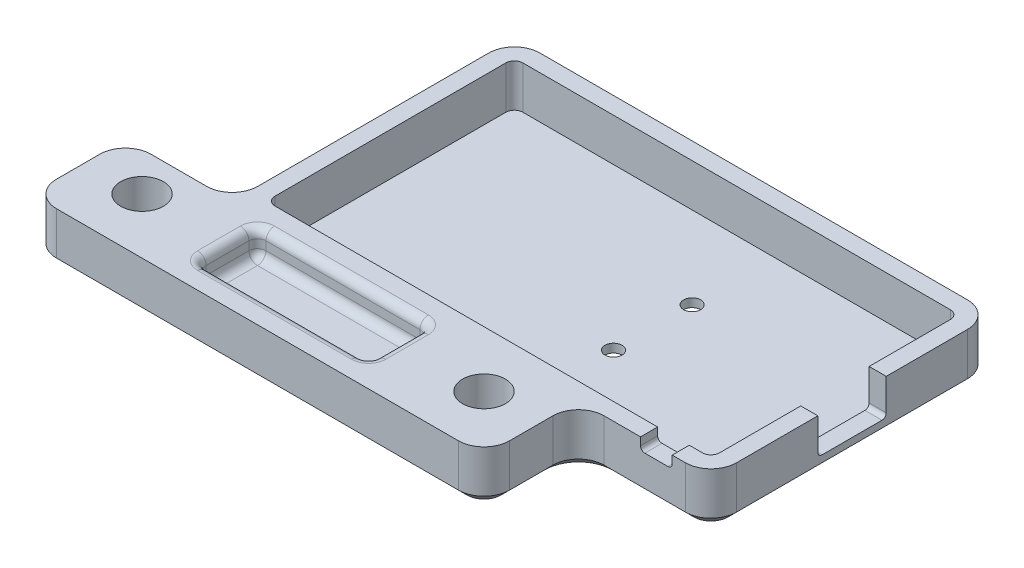
from build123d import *

# Parameters (mm, degrees)
SKETCH1_W           = 56
SKETCH1_H           = 33
SKETCH1_W_2         = 52
SKETCH1_H_2         = 29
BOSS_EXTRUDE1_DEPTH = 5
SKETCH2_W           = 56
SKETCH2_H           = 33
BOSS_EXTRUDE2_DEPTH = 1
FILLET1_R           = 3
FILLET2_R           = 1
SKETCH3_W           = 8
SKETCH3_H           = 8.4
CUT_EXTRUDE1_DEPTH  = 10
SKETCH9_W           = 3.7
SKETCH9_H           = 2.8
CUT_EXTRUDE4_DEPTH  = 3
BOSS_EXTRUDE6_START = -6
SKETCH5_R           = 4.5
BOSS_EXTRUDE6_DEPTH = 6
SKETCH7_R           = 4.5
SKETCH7_R_2         = 2.5
BOSS_EXTRUDE7_DEPTH = 5
FILLET4_R           = 3
SKETCH8_W           = 20
SKETCH8_H           = 7
CUT_EXTRUDE3_DEPTH  = 3
FILLET5_R           = 1
CHAMFER2_SIZE       = 1
FILLET6_R           = 0.5
SKETCH10_R          = 1
CUT_EXTRUDE5_DEPTH  = 3


with BuildPart() as part:
    # Sketch1 → Boss-Extrude1 (new body)
    with BuildSketch(Plane(origin=(0, 0, 0), x_dir=(1, 0, 0), z_dir=(0, 1, 0))):
        Rectangle(SKETCH1_W, SKETCH1_H)
        Rectangle(SKETCH1_W_2, SKETCH1_H_2, mode=Mode.SUBTRACT)
    extrude(amount=BOSS_EXTRUDE1_DEPTH)

    # Sketch2 → Boss-Extrude2 (add)
    with BuildSketch(Plane.XZ):
        Rectangle(SKETCH2_W, SKETCH2_H)
    extrude(amount=BOSS_EXTRUDE2_DEPTH)

    # Fillet1
    fillet1_edges = [part.edges().sort_by_distance(p)[0] for p in [
        (-28, 2, -16.5),
        (28, 2, -16.5),
        (28, 2, 16.5),
        (-28, 2, 16.5),
    ]]
    fillet(fillet1_edges, radius=FILLET1_R)

    # Fillet2
    fillet2_edges = [part.edges().sort_by_distance(p)[0] for p in [
        (26, 2.5, 14.5),
        (26, 2.5, -14.5),
        (-26, 2.5, -14.5),
        (-26, 2.5, 14.5),
    ]]
    fillet(fillet2_edges, radius=FILLET2_R)

    # Sketch3 → Cut-Extrude1 (cut)
    with BuildSketch(Plane(origin=(28, 0, 0), x_dir=(0, 0, -1), z_dir=(1, 0, 0))):
        with Locations((0, 5)):
            Rectangle(SKETCH3_W, SKETCH3_H)
    extrude(amount=-CUT_EXTRUDE1_DEPTH, mode=Mode.SUBTRACT)

    # Sketch9 → Cut-Extrude4 (cut)
    with BuildSketch(Plane.XY.offset(16.5)):
        with Locations((21.611723176, 5)):
            Rectangle(SKETCH9_W, SKETCH9_H)
    extrude(amount=-CUT_EXTRUDE4_DEPTH, mode=Mode.SUBTRACT)

    # Sketch5 → Boss-Extrude6 (add)
    # profile 1 of 3: a face of its own
    with BuildSketch(Plane.XZ.offset(1).offset(BOSS_EXTRUDE6_START)):
        Polygon((-25, 16.5), (12.5, 16.5), (12.5, 27.55), (-40.5, 27.55), (-40.5, 16.5), (-28, 16.5), align=None)
        with Locations(Location((-34, 21.05, 0), (0, 0, 270))):
            Circle(SKETCH5_R, mode=Mode.SUBTRACT)
        with Locations(Location((6, 21.05, 0), (0, 0, 270))):
            Circle(SKETCH5_R, mode=Mode.SUBTRACT)
    # profile 2 of 3: a face of its own
    with BuildSketch(Plane.XZ.offset(1).offset(BOSS_EXTRUDE6_START)):
        with BuildLine():
            ThreePointArc((-27.252149964, 15.481872988), (-26.2357955, 16.233643993), (-25, 16.5))
            Line((-25, 16.5), (-28, 16.5))
            Line((-28, 16.5), (-28, 15.481872988))
            Line((-28, 15.481872988), (-27.252149964, 15.481872988))
        make_face()
    # profile 3 of 3: a face of its own
    with BuildSketch(Plane.XZ.offset(1).offset(BOSS_EXTRUDE6_START)):
        with BuildLine():
            ThreePointArc((-28, 13.5), (-27.806817583, 14.559138826), (-27.252149964, 15.481872988))
            Line((-27.252149964, 15.481872988), (-28, 15.481872988))
            Line((-28, 15.481872988), (-28, 13.5))
        make_face()
    extrude(amount=BOSS_EXTRUDE6_DEPTH)

    # Sketch7 → Boss-Extrude7 (add)
    # profile 1 of 2: a face of its own
    with BuildSketch(Plane(origin=(0, 5, 0), x_dir=(1, 0, 0), z_dir=(0, 1, 0))):
        with Locations(Location((6, -21.05, 0), (0, 0, 90))):
            Circle(SKETCH7_R)
        with Locations(Location((6, -21.05, 0), (0, 0, 270))):
            Circle(SKETCH7_R_2, mode=Mode.SUBTRACT)
    # profile 2 of 2: a face of its own
    with BuildSketch(Plane(origin=(0, 5, 0), x_dir=(1, 0, 0), z_dir=(0, 1, 0))):
        with Locations(Location((-34, -21.05, 0), (0, 0, 90))):
            Circle(SKETCH7_R)
        with Locations(Location((-34, -21.05, 0), (0, 0, 270))):
            Circle(SKETCH7_R_2, mode=Mode.SUBTRACT)
    extrude(amount=-BOSS_EXTRUDE7_DEPTH)

    # Fillet4
    fillet4_edges = [part.edges().sort_by_distance(p)[0] for p in [
        (-40.5, 2, 16.5),
        (-40.5, 2, 27.55),
        (12.5, 2, 27.55),
        (12.5, 2, 16.5),
        (-28, 2, 16.5),
    ]]
    fillet(fillet4_edges, radius=FILLET4_R)

    # Sketch8 → Cut-Extrude3 (cut)
    with BuildSketch(Plane(origin=(0, 5, 0), x_dir=(1, 0, 0), z_dir=(0, 1, 0))):
        with Locations((-14, -21.05)):
            Rectangle(SKETCH8_W, SKETCH8_H)
    extrude(amount=-CUT_EXTRUDE3_DEPTH, mode=Mode.SUBTRACT)

    # Fillet5
    fillet5_edges = [part.edges().sort_by_distance(p)[0] for p in [
        (-4, 2, 21.05),
        (-4, 3.5, 17.55),
        (-14, 2, 24.55),
        (-4, 3.5, 24.55),
        (-24, 2, 21.05),
        (-24, 3.5, 24.55),
        (-14, 2, 17.55),
        (-24, 3.5, 17.55),
        (-4, 5, 21.05),
        (-14, 5, 17.55),
        (-24, 5, 21.05),
        (-14, 5, 24.55),
    ]]
    fillet(fillet5_edges, radius=FILLET5_R)

    # Chamfer2
    # the kernel refuses this chamfer: 1 mm, written as the material it takes off along each edge
    with BuildSketch(Plane(origin=(12.5, -1, 19.5), x_dir=(0.02749587661058563, 0.9996219169112968, 0), z_dir=(0, 0, 1)), Plane(origin=(-40.5, -1, 24.55), x_dir=(-0.02749587661058908, 0.9996219169112968, 0), z_dir=(0, 0, -1))) as chamfer2_piece_1:
        Polygon((CHAMFER2_SIZE * 0.999621916911, CHAMFER2_SIZE * 0.0274958766106), (-CHAMFER2_SIZE * 0.0274958766106, CHAMFER2_SIZE * 0.999621916911), (0, 0), align=None)
    extrude(amount=5.05, mode=Mode.SUBTRACT)
    with BuildSketch(Plane(origin=(9.5, -1, 27.55), x_dir=(0, 0.9996219169112968, 0.02749587661058563), z_dir=(-1, 0, 0))) as chamfer2_piece_2:
        Polygon((CHAMFER2_SIZE * 0.999621916911, CHAMFER2_SIZE * 0.0274958766106), (-CHAMFER2_SIZE * 0.0274958766106, CHAMFER2_SIZE * 0.999621916911), (0, 0), align=None)
    extrude(amount=47, mode=Mode.SUBTRACT)
    with BuildSketch(Plane(origin=(-31, -1, 16.5), x_dir=(0, 0.9996219169112968, -0.02749587661058563), z_dir=(-1, 0, 0))) as chamfer2_piece_3:
        Polygon((CHAMFER2_SIZE * 0.999621916911, -CHAMFER2_SIZE * 0.0274958766106), (-CHAMFER2_SIZE * 0.0274958766106, -CHAMFER2_SIZE * 0.999621916911), (0, 0), align=None)
    extrude(amount=6.5, mode=Mode.SUBTRACT)
    with BuildSketch(Plane(origin=(-28, -1, -13.5), x_dir=(-0.02749587661058563, 0.9996219169112968, 0), z_dir=(0, 0, 1))) as chamfer2_piece_4:
        Polygon((CHAMFER2_SIZE * 0.999621916911, -CHAMFER2_SIZE * 0.0274958766106), (-CHAMFER2_SIZE * 0.0274958766106, -CHAMFER2_SIZE * 0.999621916911), (0, 0), align=None)
    extrude(amount=27, mode=Mode.SUBTRACT)
    with BuildSketch(Plane(origin=(-37.5, -1, 19.5), x_dir=(-1, 0, 0), z_dir=(0, 0, 1))) as chamfer2_piece_5:
        Polygon((3, -CHAMFER2_SIZE), (3 - CHAMFER2_SIZE, 0), (3, 0), align=None)
    revolve(axis=Axis((-37.5, -1, 19.5), (0, -1, 0)), revolution_arc=90, mode=Mode.SUBTRACT)
    with BuildSketch(Plane(origin=(-37.5, -1, 24.55), x_dir=(0, 0, 1), z_dir=(1, 0, 0))) as chamfer2_piece_6:
        Polygon((3, -CHAMFER2_SIZE), (3 - CHAMFER2_SIZE, 0), (3, 0), align=None)
    revolve(axis=Axis((-37.5, -1, 24.55), (0, -1, 0)), revolution_arc=90, mode=Mode.SUBTRACT)
    with BuildSketch(Plane(origin=(9.5, -1, 24.55), x_dir=(1, 0, 0), z_dir=(0, 0, -1))) as chamfer2_piece_7:
        Polygon((3, -CHAMFER2_SIZE), (3 - CHAMFER2_SIZE, 0), (3, 0), align=None)
    revolve(axis=Axis((9.5, -1, 24.55), (0, -1, 0)), revolution_arc=90, mode=Mode.SUBTRACT)
    with BuildSketch(Plane(origin=(15.5, -1, 19.5), x_dir=(0, 0, -1), z_dir=(1, 0, 0))) as chamfer2_piece_8:
        Polygon((3, CHAMFER2_SIZE), (3 + CHAMFER2_SIZE, 0), (3, 0), align=None)
    revolve(axis=Axis((15.5, -1, 19.5), (0, 1, 0)), revolution_arc=90, mode=Mode.SUBTRACT)
    with BuildSketch(Plane(origin=(-31, -1, 13.5), x_dir=(0, 0, 1), z_dir=(-1, 0, 0))) as chamfer2_piece_9:
        Polygon((3, CHAMFER2_SIZE), (3 + CHAMFER2_SIZE, 0), (3, 0), align=None)
    revolve(axis=Axis((-31, -1, 13.5), (0, 1, 0)), revolution_arc=90, mode=Mode.SUBTRACT)
    with BuildSketch(Plane(origin=(28, -1, -13.5), x_dir=(0.02749587661058563, 0.9996219169112968, 0), z_dir=(0, 0, 1))) as chamfer2_piece_10:
        Polygon((CHAMFER2_SIZE * 0.999621916911, CHAMFER2_SIZE * 0.0274958766106), (-CHAMFER2_SIZE * 0.0274958766106, CHAMFER2_SIZE * 0.999621916911), (0, 0), align=None)
    extrude(amount=27, mode=Mode.SUBTRACT)
    with BuildSketch(Plane(origin=(25, -1, 16.5), x_dir=(0, 0.9996219169112968, 0.02749587661058563), z_dir=(-1, 0, 0))) as chamfer2_piece_11:
        Polygon((CHAMFER2_SIZE * 0.999621916911, CHAMFER2_SIZE * 0.0274958766106), (-CHAMFER2_SIZE * 0.0274958766106, CHAMFER2_SIZE * 0.999621916911), (0, 0), align=None)
    extrude(amount=9.5, mode=Mode.SUBTRACT)
    with BuildSketch(Plane(origin=(-25, -1, -16.5), x_dir=(0, 0.9996219169112968, -0.02749587661058563), z_dir=(1, 0, 0))) as chamfer2_piece_12:
        Polygon((CHAMFER2_SIZE * 0.999621916911, CHAMFER2_SIZE * 0.0274958766106), (-CHAMFER2_SIZE * 0.0274958766106, CHAMFER2_SIZE * 0.999621916911), (0, 0), align=None)
    extrude(amount=50, mode=Mode.SUBTRACT)
    with BuildSketch(Plane(origin=(-25, -1, -13.5), x_dir=(0, 0, -1), z_dir=(1, 0, 0))) as chamfer2_piece_13:
        Polygon((3, CHAMFER2_SIZE), (3 - CHAMFER2_SIZE, 0), (3, 0), align=None)
    revolve(axis=Axis((-25, -1, -13.5), (0, 1, 0)), revolution_arc=90, mode=Mode.SUBTRACT)
    with BuildSketch(Plane(origin=(25, -1, -13.5), x_dir=(0, 0, -1), z_dir=(-1, 0, 0))) as chamfer2_piece_14:
        Polygon((3, -CHAMFER2_SIZE), (3 - CHAMFER2_SIZE, 0), (3, 0), align=None)
    revolve(axis=Axis((25, -1, -13.5), (0, -1, 0)), revolution_arc=90, mode=Mode.SUBTRACT)
    with BuildSketch(Plane(origin=(25, -1, 13.5), x_dir=(0, 0, 1), z_dir=(-1, 0, 0))) as chamfer2_piece_15:
        Polygon((3 - CHAMFER2_SIZE, 0), (3, CHAMFER2_SIZE), (3, 0), align=None)
    revolve(axis=Axis((25, -1, 13.5), (0, 1, 0)), revolution_arc=90, mode=Mode.SUBTRACT)

    # Fillet6
    fillet6_edges = [part.edges().sort_by_distance(p)[0] for p in [
        (27, 0.8, -4),
        (19.761723176, 3.6, 15.5),
        (23.461723176, 3.6, 15.5),
        (27, 0.8, 4),
    ]]
    fillet(fillet6_edges, radius=FILLET6_R)

    # Sketch10 → Cut-Extrude5 (cut)
    with BuildSketch(Plane(origin=(0, 0, 0), x_dir=(1, 0, 0), z_dir=(0, 1, 0))):
        with Locations(Location((4.4, 4.9, 0), (0, 0, 270))):
            Circle(SKETCH10_R)
        with Locations(Location((4.4, -4.3, 0), (0, 0, 270))):
            Circle(SKETCH10_R)
    extrude(amount=-CUT_EXTRUDE5_DEPTH, mode=Mode.SUBTRACT)


solid = part.part
